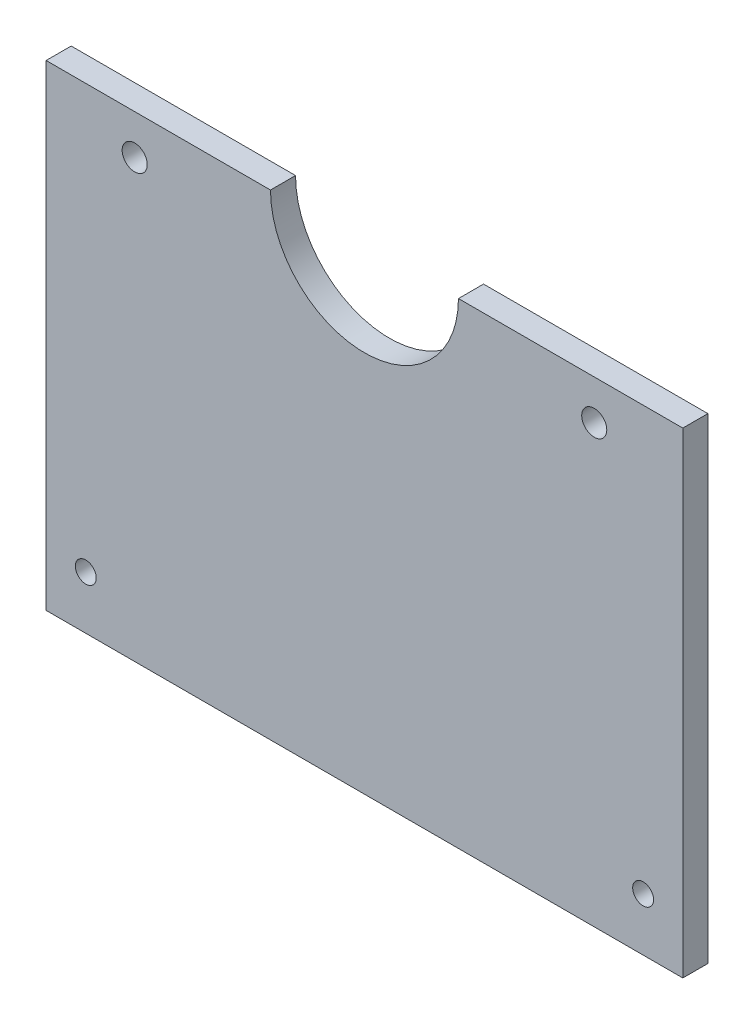
from build123d import *

# Parameters (mm, degrees)
SKETCH2_R           = 3
BOSS_EXTRUDE1_DEPTH = 3
SKETCH3_R           = 2.5
CUT_EXTRUDE1_DEPTH  = 6


with BuildPart() as part:
    # Sketch2 → Boss-Extrude1 (new, symmetric)
    with BuildSketch(Plane.XY):
        with BuildLine():
            Line((-76.2, 0), (76.2, 0))
            Line((76.2, 0), (76.2, 114))
            Line((76.2, 114), (22.5, 114))
            ThreePointArc((22.5, 114), (0, 91.5), (-22.5, 114))
            Line((-22.5, 114), (-76.2, 114))
            Line((-76.2, 114), (-76.2, 0))
        make_face()
        with Locations((-55, 104.5)):
            Circle(SKETCH2_R, mode=Mode.SUBTRACT)
        with Locations((55, 104.5)):
            Circle(SKETCH2_R, mode=Mode.SUBTRACT)
    extrude(amount=BOSS_EXTRUDE1_DEPTH, both=True)

    # Sketch3 → Cut-Extrude1 (cut)
    with BuildSketch(Plane.XY.offset(3)):
        with Locations((-66.7, 12.7)):
            Circle(SKETCH3_R)
        with Locations((66.7, 12.7)):
            Circle(SKETCH3_R)
    extrude(amount=-CUT_EXTRUDE1_DEPTH, mode=Mode.SUBTRACT)


solid = part.part
